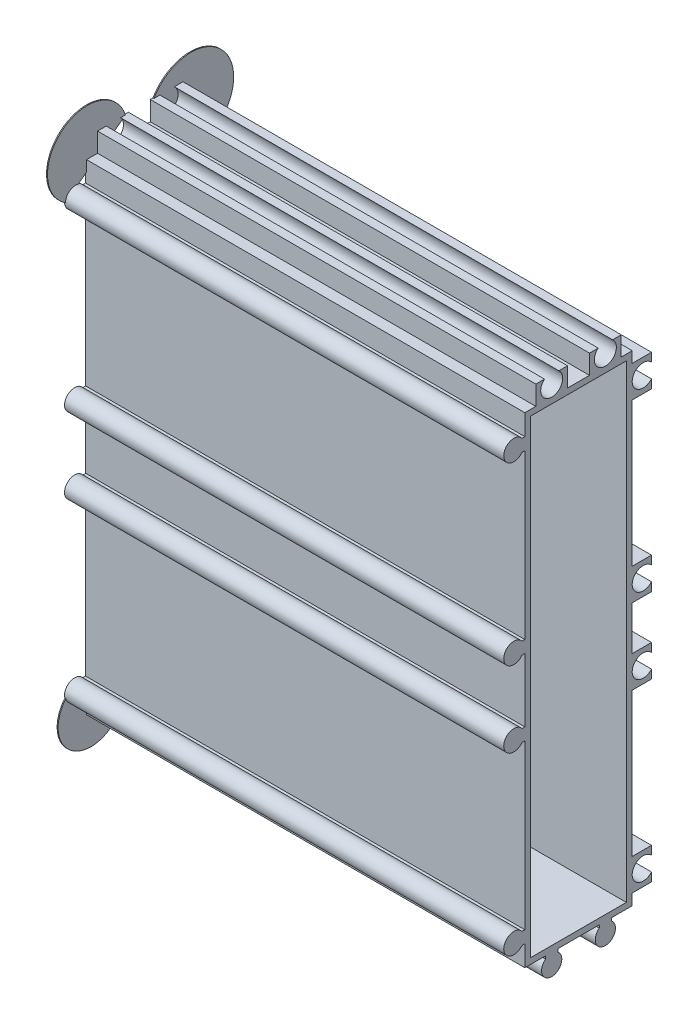
from build123d import *

# Parameters (mm, degrees)
EXTRUDE_1_DEPTH     = 90
SKETCH_2_W          = 90
SKETCH_2_H          = 17.75
EXTRUDE_2_DEPTH     = 8.2
SKETCH_3_W          = 90
SKETCH_3_H          = 102.45
EXTRUDE_3_DEPTH     = 8.2
SKETCH_4_W          = 3.95
SKETCH_4_H          = 2.25
CUT_EXTRUDE_1_DEPTH = 171.45954982
SKETCH_5_W          = 3.95
SKETCH_5_H          = 29.5
CUT_EXTRUDE_2_DEPTH = 171.45954982
SKETCH_6_W          = 3.95
SKETCH_6_H          = 9
CUT_EXTRUDE_3_DEPTH = 171.45954982
SKETCH_7_W          = 3.95
SKETCH_7_H          = 29.5
CUT_EXTRUDE_4_DEPTH = 171.45954982
SKETCH_8_W          = 3.95
SKETCH_8_H          = 6.2
CUT_EXTRUDE_5_DEPTH = 171.45954982
SKETCH_9_W          = 2.25
SKETCH_9_H          = 3.95
CUT_EXTRUDE_6_DEPTH = 171.45954982
SKETCH_10_W         = 4.5
SKETCH_10_H         = 3.95
CUT_EXTRUDE_7_DEPTH = 171.45954982
SKETCH_11_W         = 2.25
SKETCH_11_H         = 3.95
CUT_EXTRUDE_8_DEPTH = 171.45954982
SKETCH_12_W         = 19.6
SKETCH_12_H         = 96.1
CUT_EXTRUDE_9_DEPTH = 86.2
EXTRUDE_START       = -90
EXTRUDE_5_DEPTH     = 90
EXTRUDE_6_DEPTH     = 0.2


# Read off the part's stored shape, not the designer's step: Бобышка-Вытянуть5
with BuildPart() as part:
    # Эскиз1 → Бобышка-Вытянуть1 (new body)
    with BuildSketch(Plane(origin=(90, 0, 0), x_dir=(0, 0, -1), z_dir=(1, 0, 0))):
        with BuildLine():
            Line((6.75, 40.906238208), (6.75, 135.75))
            Line((6.75, 135.75), (-11.593761792, 135.75))
            ThreePointArc((-11.593761792, 135.75), (-15.325, 134.5), (-11.593761793, 133.25))
            Line((-11.593761793, 133.25), (-11, 133.25))
            Line((-11, 133.25), (-11, 99.75))
            Line((-11, 99.75), (-11.593761792, 99.75))
            ThreePointArc((-11.593761792, 99.75), (-15.325, 98.5), (-11.593761792, 97.25))
            Line((-11.593761792, 97.25), (-11, 97.25))
            Line((-11, 97.25), (-11, 84.25))
            Line((-11, 84.25), (-11.593761792, 84.25))
            ThreePointArc((-11.593761792, 84.25), (-15.325, 83), (-11.593761792, 81.75))
            Line((-11.593761792, 81.75), (-11, 81.75))
            Line((-11, 81.75), (-11, 48.25))
            Line((-11, 48.25), (-11.593761792, 48.25))
            ThreePointArc((-11.593761792, 48.25), (-15.325, 47), (-11.593761792, 45.75))
            Line((-11.593761792, 45.75), (-11, 45.75))
            Line((-11, 45.75), (-11, 41.5))
            Line((-11, 41.5), (-6.75, 41.5))
            Line((-6.75, 41.5), (-6.75, 40.906238208))
            ThreePointArc((-6.75, 40.906238208), (-5.5, 37.175), (-4.25, 40.906238208))
            Line((-4.25, 40.906238208), (-4.25, 41.5))
            Line((-4.25, 41.5), (4.25, 41.5))
            Line((4.25, 41.5), (4.25, 40.906238208))
            ThreePointArc((4.25, 40.906238208), (5.5, 37.175), (6.75, 40.906238208))
        make_face()
    extrude(amount=-EXTRUDE_1_DEPTH)

    # Эскиз2 → Бобышка-Вытянуть2 (add)
    with BuildSketch(Plane(origin=(0, 135.75, 0), x_dir=(-1, 0, 0), z_dir=(0, 1, 0))):
        with Locations((-45, 2.125)):
            Rectangle(SKETCH_2_W, SKETCH_2_H)
    extrude(amount=EXTRUDE_2_DEPTH)

    # Эскиз3 → Бобышка-Вытянуть3 (add)
    with BuildSketch(Plane(origin=(0, 0, -6.75), x_dir=(-1, 0, 0), z_dir=(0, 0, -1))):
        with Locations((-45, 92.725)):
            Rectangle(SKETCH_3_W, SKETCH_3_H)
    extrude(amount=EXTRUDE_3_DEPTH)

    # Эскиз4 → Вырез-Вытянуть1 (cut, through all)
    with BuildSketch(Plane.ZY):
        with Locations((-12.975, 42.625)):
            Rectangle(SKETCH_4_W, SKETCH_4_H)
    extrude(amount=-CUT_EXTRUDE_1_DEPTH, mode=Mode.SUBTRACT)

    # Эскиз5 → Вырез-Вытянуть2 (cut, through all)
    with BuildSketch(Plane.ZY):
        with Locations((-12.975, 65)):
            Rectangle(SKETCH_5_W, SKETCH_5_H)
    extrude(amount=-CUT_EXTRUDE_2_DEPTH, mode=Mode.SUBTRACT)

    # Эскиз6 → Вырез-Вытянуть3 (cut, through all)
    with BuildSketch(Plane.ZY):
        with Locations((-12.975, 90.75)):
            Rectangle(SKETCH_6_W, SKETCH_6_H)
    extrude(amount=-CUT_EXTRUDE_3_DEPTH, mode=Mode.SUBTRACT)

    # Эскиз7 → Вырез-Вытянуть4 (cut, through all)
    with BuildSketch(Plane.ZY):
        with Locations((-12.975, 116.5)):
            Rectangle(SKETCH_7_W, SKETCH_7_H)
    extrude(amount=-CUT_EXTRUDE_4_DEPTH, mode=Mode.SUBTRACT)

    # Эскиз8 → Вырез-Вытянуть5 (cut, through all)
    with BuildSketch(Plane.ZY):
        with Locations((-12.975, 140.85)):
            Rectangle(SKETCH_8_W, SKETCH_8_H)
    extrude(amount=-CUT_EXTRUDE_5_DEPTH, mode=Mode.SUBTRACT)

    # Эскиз9 → Вырез-Вытянуть6 (cut, through all)
    with BuildSketch(Plane.ZY):
        with Locations((-9.875, 141.975)):
            Rectangle(SKETCH_9_W, SKETCH_9_H)
    extrude(amount=-CUT_EXTRUDE_6_DEPTH, mode=Mode.SUBTRACT)

    # Эскиз10 → Вырез-Вытянуть7 (cut, through all)
    with BuildSketch(Plane.ZY):
        with Locations((0, 141.975)):
            Rectangle(SKETCH_10_W, SKETCH_10_H)
    extrude(amount=-CUT_EXTRUDE_7_DEPTH, mode=Mode.SUBTRACT)

    # Эскиз11 → Вырез-Вытянуть8 (cut, through all)
    with BuildSketch(Plane.ZY):
        with Locations((9.875, 141.975)):
            Rectangle(SKETCH_11_W, SKETCH_11_H)
    extrude(amount=-CUT_EXTRUDE_8_DEPTH, mode=Mode.SUBTRACT)

    # Эскиз12 → Вырез-Вытянуть9 (cut)
    with BuildSketch(Plane(origin=(90, 0, 0), x_dir=(0, 0, -1), z_dir=(1, 0, 0))):
        with Locations((0, 90.75)):
            Rectangle(SKETCH_12_W, SKETCH_12_H)
    extrude(amount=-CUT_EXTRUDE_9_DEPTH, mode=Mode.SUBTRACT)

    # Бобышка-Вытянуть5 outline → Бобышка-Вытянуть5 (cut)
    with BuildSketch(Plane(origin=(90, 0, 0), x_dir=(0, 0, -1), z_dir=(1, 0, 0)).offset(EXTRUDE_START)):
        with BuildLine():
            ThreePointArc((-6.973940297, 143.95), (-5.5, 140), (-4.026059703, 143.95))
            Line((-4.026059703, 143.95), (-6.973940297, 143.95))
        make_face()
        with BuildLine():
            ThreePointArc((4.026059703, 143.95), (5.5, 140), (6.973940297, 143.95))
            Line((6.973940297, 143.95), (4.026059703, 143.95))
        make_face()
        with BuildLine():
            ThreePointArc((14.95, 135.973940297), (11, 134.5), (14.95, 133.026059703))
            Line((14.95, 133.026059703), (14.95, 135.973940297))
        make_face()
        with BuildLine():
            ThreePointArc((14.95, 99.973940297), (11, 98.5), (14.95, 97.026059703))
            Line((14.95, 97.026059703), (14.95, 99.973940297))
        make_face()
        with BuildLine():
            ThreePointArc((14.95, 84.473940297), (11, 83), (14.95, 81.526059703))
            Line((14.95, 81.526059703), (14.95, 84.473940297))
        make_face()
        with BuildLine():
            ThreePointArc((14.95, 48.473940297), (11, 47), (14.95, 45.526059703))
            Line((14.95, 45.526059703), (14.95, 48.473940297))
        make_face()
    extrude(amount=EXTRUDE_5_DEPTH, mode=Mode.SUBTRACT)

    # Эскиз21 → Бобышка-Вытянуть6 (add)
    with BuildSketch(Plane.ZY):
        with BuildLine():
            Line((-14.95, 49.276213414), (-5.5, 37.175))
            ThreePointArc((-5.5, 37.175), (-16.275606707, 38.500606707), (-14.95, 49.276213414))
        make_face()
        with BuildLine():
            Line((5.5, 37.175), (15.252051369, 46.45464203))
            ThreePointArc((15.252051369, 46.45464203), (14.740776792, 37.227868536), (5.5, 37.175))
        make_face()
        with BuildLine():
            Line((-14.95, 132.138029851), (-2.788562926, 143.95))
            ThreePointArc((-2.788562926, 143.95), (-16.483808441, 145.883823994), (-14.95, 132.138029851))
        make_face()
        with BuildLine():
            Line((15.325, 134.5), (3.036005332, 143.95))
            ThreePointArc((3.036005332, 143.95), (15.809128056, 147.845015034), (15.325, 134.5))
        make_face()
    extrude(amount=-EXTRUDE_6_DEPTH)


solid = part.part
